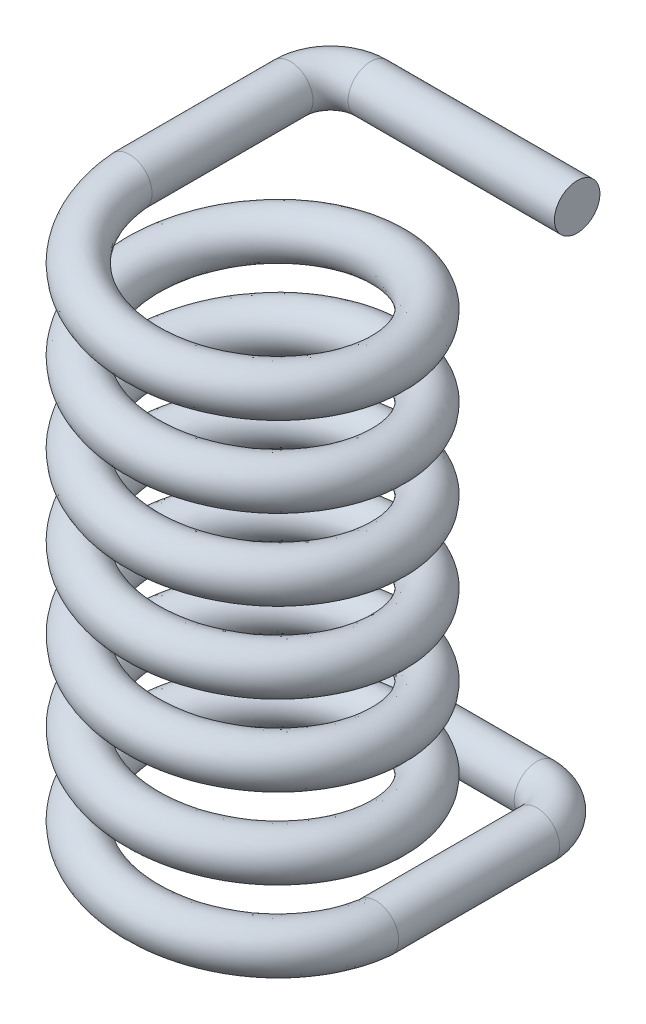
from build123d import *

# Parameters (mm, degrees)
SWEEP1_PITCH       = 4
SWEEP1_HEIGHT      = 26
SWEEP1_RADIUS      = 6.13
SWEEP1_START_ANGLE = 90
SKETCH1_R          = 1.13
SKETCH1_3_R        = 1.13
SWEEP3_OUTLINE_R   = 1.13
SWEEP3_ANGLE       = 90
SWEEP3_START       = -8.0000001
SWEEP3_2_OUTLINE_R = 1.13
SWEEP3_2_DEPTH     = 8.0000001
SWEEP3_START_2     = -4.1300001
SWEEP3_3_OUTLINE_R = 1.13
SWEEP3_3_DEPTH     = 10.2600001


with BuildPart() as part:
    # Sweep1: sweep along a helix
    with BuildLine() as sweep1_path:
        add(Helix(SWEEP1_PITCH, SWEEP1_HEIGHT, SWEEP1_RADIUS, center=(0, 0, 0), direction=(0, 1, 0), lefthand=True, mode=Mode.PRIVATE).rotate(Axis((0, 0, 0), (0, 1, 0)), SWEEP1_START_ANGLE))
    # Sketch1 → Sweep1 (sweep)
    with BuildSketch(Plane.XY):
        with Locations((6.13, 0)):
            Circle(SKETCH1_R)
    sweep(path=sweep1_path.line, is_frenet=True)

    # Sweep2: sweep along a path in Sketch3
    with BuildLine(Plane(origin=(0, 0, 0), x_dir=(1, 0, 0), z_dir=(0, 1, 0))) as sweep2_path:
        Line((6.13, 0), (6.13, 8))
        ThreePointArc((6.13, 8), (5.544213562, 9.414213562), (4.13, 10))
        Line((4.13, 10), (-6.13, 10))
    # Sketch1<3> → Sweep2 (sweep)
    with BuildSketch(Plane.XY):
        with Locations((6.13, 0)):
            Circle(SKETCH1_3_R)
    sweep(path=sweep2_path.line)



with BuildPart() as body_2:
    # Sweep3: read off the stored shape, not the designer's step
    # Sweep3 outline → Sweep3 (revolve)
    with BuildSketch(Plane(origin=(-4.13, 0, -8), x_dir=(0, 0, -1), z_dir=(1, 0, 0))):
        with Locations((2, 26)):
            Circle(SWEEP3_OUTLINE_R)
    revolve(axis=Axis((-4.13, 0, -8), (0, 1, 0)), revolution_arc=SWEEP3_ANGLE)


with BuildPart() as part_1:
    add(part.part)

    add(body_2.part)  # Sweep3 2 merges body 2
    # Sweep3 2 outline → Sweep3 2 (add)
    with BuildSketch(Plane.XY.offset(SWEEP3_START)):
        with Locations((-6.13, 26)):
            Circle(SWEEP3_2_OUTLINE_R)
    extrude(amount=SWEEP3_2_DEPTH)

    # Sweep3 3 outline → Sweep3 3 (add)
    with BuildSketch(Plane.YZ.offset(SWEEP3_START_2)):
        with Locations((26, -10)):
            Circle(SWEEP3_3_OUTLINE_R)
    extrude(amount=SWEEP3_3_DEPTH)


solid = part_1.part
